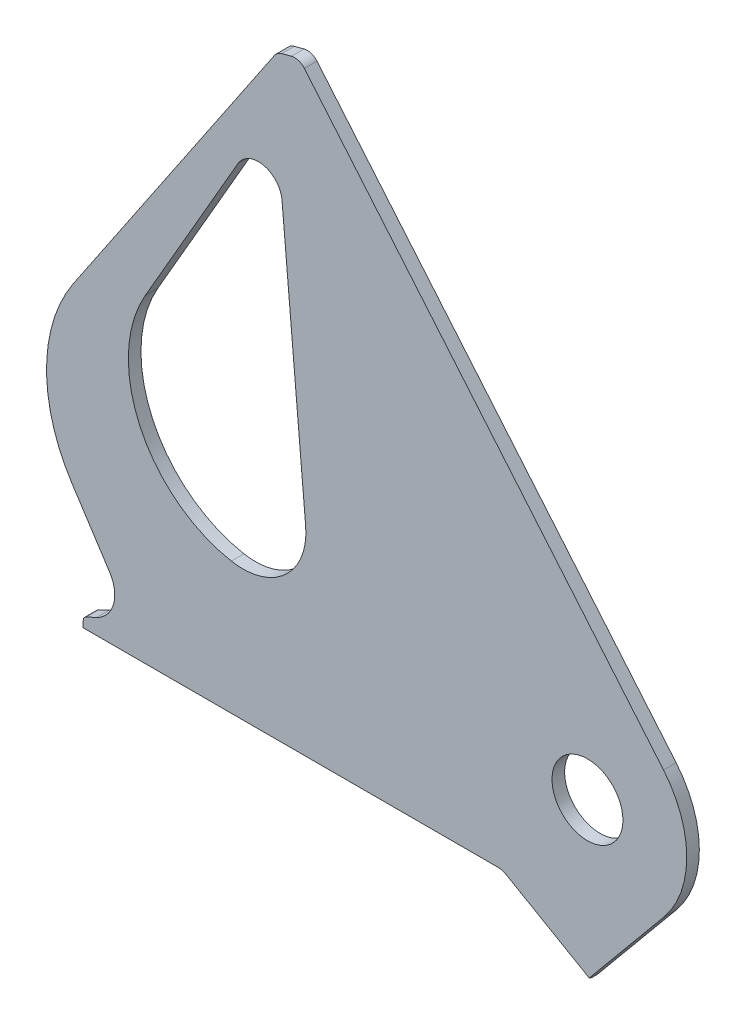
from build123d import *

# Parameters (mm, degrees)
SKETCH1_R                          = 22.5
EXTRUDE1_DEPTH                     = 8
F_7_X_45_GR_SK_RPNING_VENSTRE_SIZE = 7


with BuildPart() as part:
    # Sketch1 → Extrude1 (new body)
    with BuildSketch(Plane.XY):
        with BuildLine():
            Line((-317, -72.5), (-56.803847577, -72.5))
            ThreePointArc((-56.803847577, -72.5), (-56.027390442, -72.602222521), (-55.303847577, -72.901923789))
            Line((-55.303847577, -72.901923789), (-5.600653599, -101.598076211))
            ThreePointArc((-5.600653599, -101.598076211), (-3.570421982, -101.952770637), (-1.790438983, -100.913872625))
            Line((-1.790438983, -100.913872625), (48.51450695, -40.191325127))
            ThreePointArc((48.51450695, -40.191325127), (62.999688566, 0.19809232), (48.260799916, 40.49561941))
            Line((48.260799916, 40.49561941), (-179.677830313, 312.142300877))
            ThreePointArc((-179.677830313, 312.142300877), (-183.400539462, 314.629735606), (-187.876738219, 314.72740661))
            Line((-187.876738219, 314.72740661), (-194.064678331, 313.069353055))
            ThreePointArc((-194.064678331, 313.069353055), (-196.639749615, 311.854870591), (-198.62642655, 309.815489672))
            Line((-198.62642655, 309.815489672), (-326.192869732, 120.690460119))
            ThreePointArc((-326.192869732, 120.690460119), (-343.285304783, 65.643823322), (-327.156169271, 10.30726627))
            Line((-327.156169271, 10.30726627), (-303.226588641, -26.54105654))
            ThreePointArc((-303.226588641, -26.54105654), (-300.774766081, -42.946584357), (-311.547634765, -55.559992981))
            Line((-311.547634765, -55.559992981), (-318.267854785, -58.693683041))
            ThreePointArc((-318.267854785, -58.693683041), (-319.530174337, -59.800707577), (-320, -61.412606402))
            Line((-320, -61.412606402), (-320, -69.5))
            ThreePointArc((-320, -69.5), (-319.121320344, -71.621320344), (-317, -72.5))
        make_face()
        Circle(SKETCH1_R, mode=Mode.SUBTRACT)
        with BuildLine():
            Line((-193.85365949, 232.607111101), (-178.838777944, 60.98622971))
            ThreePointArc((-178.838777944, 60.98622971), (-191.798712106, 27.885082811), (-225.99409877, 18.173164851))
            ThreePointArc((-225.99409877, 18.173164851), (-284.038197126, 63.350786049), (-280.661065267, 136.826835149))
            Line((-280.661065267, 136.826835149), (-221.786961018, 238.79977496))
            ThreePointArc((-221.786961018, 238.79977496), (-205.549985752, 245.944215066), (-193.85365949, 232.607111101))
        make_face(mode=Mode.SUBTRACT)
    extrude(amount=EXTRUDE1_DEPTH)

    # 7 x 45 gr skærpning - Venstre
    # the kernel refuses this chamfer: 7 mm, written as the material it takes off along each edge
    with BuildSketch(Plane(origin=(-55.303847577, -72.901923789, 8), x_dir=(-0.013747938305292761, -0.02381212764408935, -0.9996219169112969), z_dir=(0.8660254037844379, -0.5000000000000012, 0))) as f_7_x_45_gr_sk_rpning_venstre_piece_1:
        Polygon((F_7_X_45_GR_SK_RPNING_VENSTRE_SIZE * 0.999621916911, F_7_X_45_GR_SK_RPNING_VENSTRE_SIZE * 0.0274958766106), (-F_7_X_45_GR_SK_RPNING_VENSTRE_SIZE * 0.0274958766106, F_7_X_45_GR_SK_RPNING_VENSTRE_SIZE * 0.999621916911), (0, 0), align=None)
    extrude(amount=75.394085761, mode=Mode.SUBTRACT)
    with BuildSketch(Plane(origin=(-56.803847577, -75.5, 8), x_dir=(0, 1, 0), z_dir=(-1, 0, 0))) as f_7_x_45_gr_sk_rpning_venstre_piece_2:
        Polygon((3, F_7_X_45_GR_SK_RPNING_VENSTRE_SIZE), (3 + F_7_X_45_GR_SK_RPNING_VENSTRE_SIZE, 0), (3, 0), align=None)
    revolve(axis=Axis((-56.803847577, -75.5, 8), (0, 0, -1)), revolution_arc=30, mode=Mode.SUBTRACT)
    with BuildSketch(Plane(origin=(-335.001780916, -72.5, 8), x_dir=(0, -0.02749587661058612, -0.9996219169112968), z_dir=(1, 0, 0))) as f_7_x_45_gr_sk_rpning_venstre_piece_3:
        Polygon((F_7_X_45_GR_SK_RPNING_VENSTRE_SIZE * 0.999621916911, F_7_X_45_GR_SK_RPNING_VENSTRE_SIZE * 0.0274958766106), (-F_7_X_45_GR_SK_RPNING_VENSTRE_SIZE * 0.0274958766106, F_7_X_45_GR_SK_RPNING_VENSTRE_SIZE * 0.999621916911), (0, 0), align=None)
    extrude(amount=278.197933338, mode=Mode.SUBTRACT)


solid = part.part
